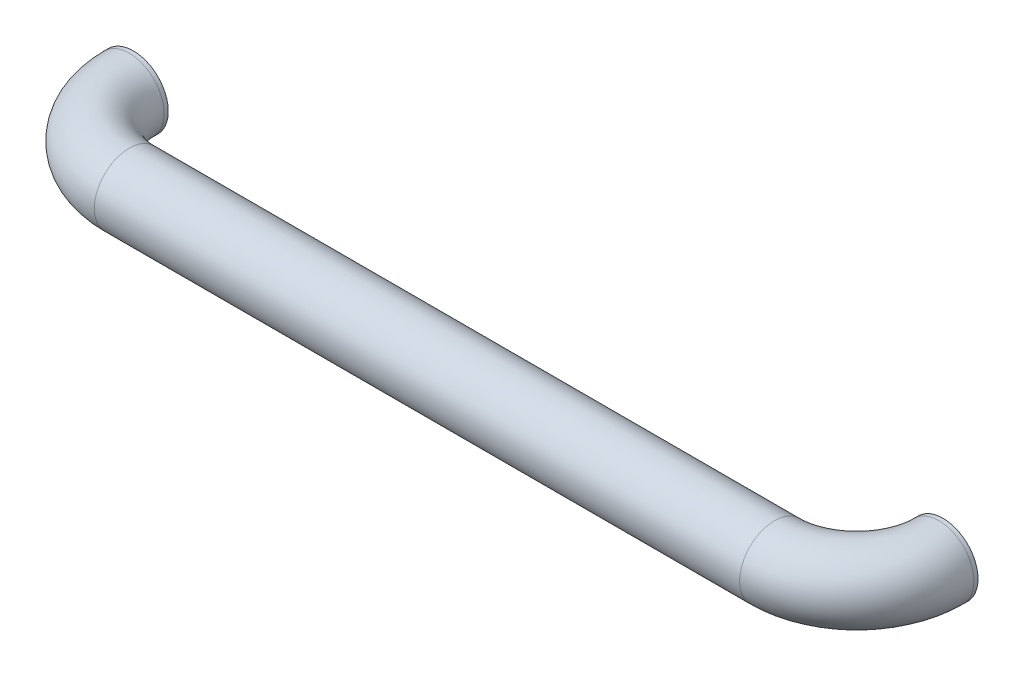
from build123d import *

# Parameters (mm, degrees)
SKETCH_2_R      = 8.5
SKETCH_2_R_2    = 8
SKETCH_5_R      = 8.5
SKETCH_5_R_2    = 2.1
EXTRUDE_1_DEPTH = 1


with BuildPart() as part:
    # 扫描1: sweep along a path in 草图1
    with BuildLine(Plane(origin=(0, 0, 0), x_dir=(1, 0, 0), z_dir=(0, 1, 0))) as sweep_1_path:
        ThreePointArc((98.5, 20), (92.642135624, 5.857864376), (78.5, 0))
        Line((78.5, 0), (-78.5, 0))
        ThreePointArc((-78.5, 0), (-92.642135624, 5.857864376), (-98.5, 20))
    # 草图2 → 扫描1 (sweep)
    with BuildSketch(Plane(origin=(0, 0, 0), x_dir=(0, 0, -1), z_dir=(1, 0, 0))):
        Circle(SKETCH_2_R)
        Circle(SKETCH_2_R_2, mode=Mode.SUBTRACT)
    sweep(path=sweep_1_path.line)

    # 草图5 → 凸台-拉伸1 (add)
    # profile 1 of 2: a face of its own
    with BuildSketch(Plane(origin=(0, 0, -20), x_dir=(-1, 0, 0), z_dir=(0, 0, -1))):
        with Locations((-98.5, 0)):
            Circle(SKETCH_5_R)
        with Locations((-98.5, 0)):
            Circle(SKETCH_5_R_2, mode=Mode.SUBTRACT)
    # profile 2 of 2: a face of its own
    with BuildSketch(Plane(origin=(0, 0, -20), x_dir=(-1, 0, 0), z_dir=(0, 0, -1))):
        with Locations((98.5, 0)):
            Circle(SKETCH_5_R)
        with Locations((98.5, 0)):
            Circle(SKETCH_5_R_2, mode=Mode.SUBTRACT)
    extrude(amount=EXTRUDE_1_DEPTH)


solid = part.part
